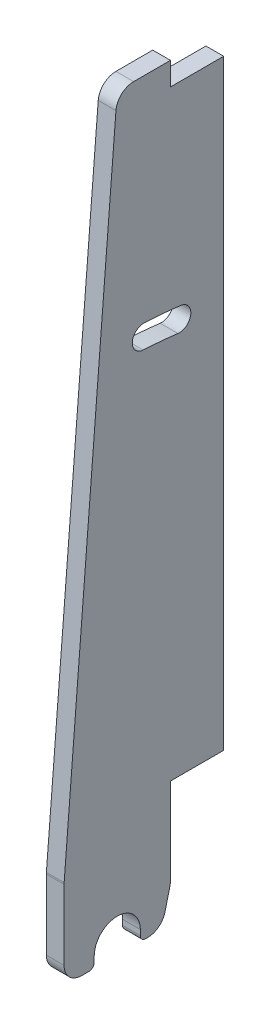
from build123d import *

# Parameters (mm, degrees)
BOSS_EXTRUDE1_DEPTH = 5
FILLET1_R           = 10
FILLET2_R           = 3
SKETCH2_W           = 30
SKETCH2_H           = 13
CUT_EXTRUDE1_DEPTH  = 358.217020871
SKETCH3_R           = 6.5
CUT_EXTRUDE2_DEPTH  = 358.217020871
CUT_EXTRUDE3_DEPTH  = 358.217020871


with BuildPart() as part:
    # Sketch1 → Boss-Extrude1 (new, symmetric)
    with BuildSketch(Plane(origin=(0, 0, 0), x_dir=(0, 0, -1), z_dir=(1, 0, 0))):
        with BuildLine():
            Line((30, 0), (0, 0))
            Line((0, 0), (0, -50))
            Line((0, -50), (-5, -70))
            Line((-5, -70), (-17, -70))
            Line((-17, -70), (-17, -64))
            ThreePointArc((-17, -64), (-30, -51), (-43, -64))
            Line((-43, -64), (-43, -70))
            Line((-43, -70), (-60, -70))
            Line((-60, -70), (-60, -20))
            Line((-60, -20), (-30, 352))
            Line((-30, 352), (30, 352))
            Line((30, 352), (30, 0))
        make_face()
    extrude(amount=BOSS_EXTRUDE1_DEPTH, both=True)

    # Fillet1
    # the kernel refuses this fillet: 10 mm, written as the material it takes off along each edge
    with BuildSketch(Plane(origin=(8.07764064, -50, 0), x_dir=(0, -0.9701425001453321, 0.24253562503633222), z_dir=(-1, 0, 0))) as fillet1_piece_1:
        with BuildLine():
            CenterArc((FILLET1_R * 0.123105625618, FILLET1_R), FILLET1_R, 255.963756532, 14.036243468)
            Line((-FILLET1_R * 0.119429999419, FILLET1_R * 0.0298574998547), (0, 0))
            Line((0, 0), (FILLET1_R * 0.123105625618, 0))
        make_face()
    extrude(amount=16.155281281, mode=Mode.SUBTRACT)
    with BuildSketch(Plane(origin=(24.51941016, -70, 5), x_dir=(0, 0, 1), z_dir=(-1, 0, 0))) as fillet1_piece_2:
        with BuildLine():
            CenterArc((FILLET1_R * 0.780776406404, FILLET1_R), FILLET1_R, 194.036243468, 75.963756532)
            Line((-FILLET1_R * 0.189366093741, FILLET1_R * 0.757464374964), (0, 0))
            Line((0, 0), (FILLET1_R * 0.780776406404, 0))
        make_face()
    extrude(amount=49.03882032, mode=Mode.SUBTRACT)
    with BuildSketch(Plane(origin=(30, -70, 60), x_dir=(0, 1, 0), z_dir=(-1, 0, 0))) as fillet1_piece_3:
        with BuildLine():
            CenterArc((FILLET1_R, FILLET1_R), FILLET1_R, 180, 90)
            Line((0, FILLET1_R), (0, 0))
            Line((0, 0), (FILLET1_R, 0))
        make_face()
    extrude(amount=60, mode=Mode.SUBTRACT)
    with BuildSketch(Plane(origin=(6.006430802, -20, 60), x_dir=(0, 0.9967639550118461, -0.08038418992029778), z_dir=(-1, 0, 0))) as fillet1_piece_4:
        with BuildLine():
            CenterArc((FILLET1_R * 0.0402572320672, FILLET1_R), FILLET1_R, 265.389350681, 4.610649319)
            Line((-FILLET1_R * 0.0401269578531, FILLET1_R * 0.00323604498815), (0, 0))
            Line((0, 0), (FILLET1_R * 0.0402572320672, 0))
        make_face()
    extrude(amount=12.012861603, mode=Mode.SUBTRACT)
    with BuildSketch(Plane(origin=(-28.065034742, 352, 30), x_dir=(0, 0, -1), z_dir=(1, 0, 0))) as fillet1_piece_5:
        with BuildLine():
            CenterArc((FILLET1_R * 0.922601389683, -FILLET1_R), FILLET1_R, 90, 85.389350681)
            Line((-FILLET1_R * 0.074162565329, -FILLET1_R * 0.91961581008), (0, 0))
            Line((0, 0), (FILLET1_R * 0.922601389683, 0))
        make_face()
    extrude(amount=56.130069484, mode=Mode.SUBTRACT)

    # Fillet2
    fillet2_edges = [part.edges().sort_by_distance(p)[0] for p in [
        (0, -70, 17),
        (0, -70, 43),
    ]]
    fillet(fillet2_edges, radius=FILLET2_R)

    # Sketch2 → Cut-Extrude1 (cut, through all)
    with BuildSketch(Plane(origin=(5, 0, 0), x_dir=(0, 0, -1), z_dir=(1, 0, 0))):
        with Locations((15, 345.5)):
            Rectangle(SKETCH2_W, SKETCH2_H)
    extrude(amount=-CUT_EXTRUDE1_DEPTH, mode=Mode.SUBTRACT)

    # Sketch3 → Cut-Extrude2 (cut, through all)
    with BuildSketch(Plane(origin=(5, 0, 0), x_dir=(0, 0, -1), z_dir=(1, 0, 0))):
        with Locations((-5, 224)):
            Circle(SKETCH3_R)
    extrude(amount=-CUT_EXTRUDE2_DEPTH, mode=Mode.SUBTRACT)

    # Sketch4 → Cut-Extrude3 (cut, through all)
    with BuildSketch(Plane(origin=(5, 0, 0), x_dir=(0, 0, -1), z_dir=(1, 0, 0))):
        with BuildLine():
            ThreePointArc((5.771557213, 229.410506159), (-4.437877767, 230.475648122), (-14.678140573, 231.185653536))
            ThreePointArc((-14.678140573, 231.185653536), (-21.506336405, 225.031326466), (-15.352009335, 218.203130634))
            ThreePointArc((-15.352009335, 218.203130634), (-5.562122233, 217.524351878), (4.198292879, 216.506055789))
            ThreePointArc((4.198292879, 216.506055789), (11.437150231, 222.171648807), (5.771557213, 229.410506159))
        make_face()
    extrude(amount=-CUT_EXTRUDE3_DEPTH, mode=Mode.SUBTRACT)


solid = part.part
